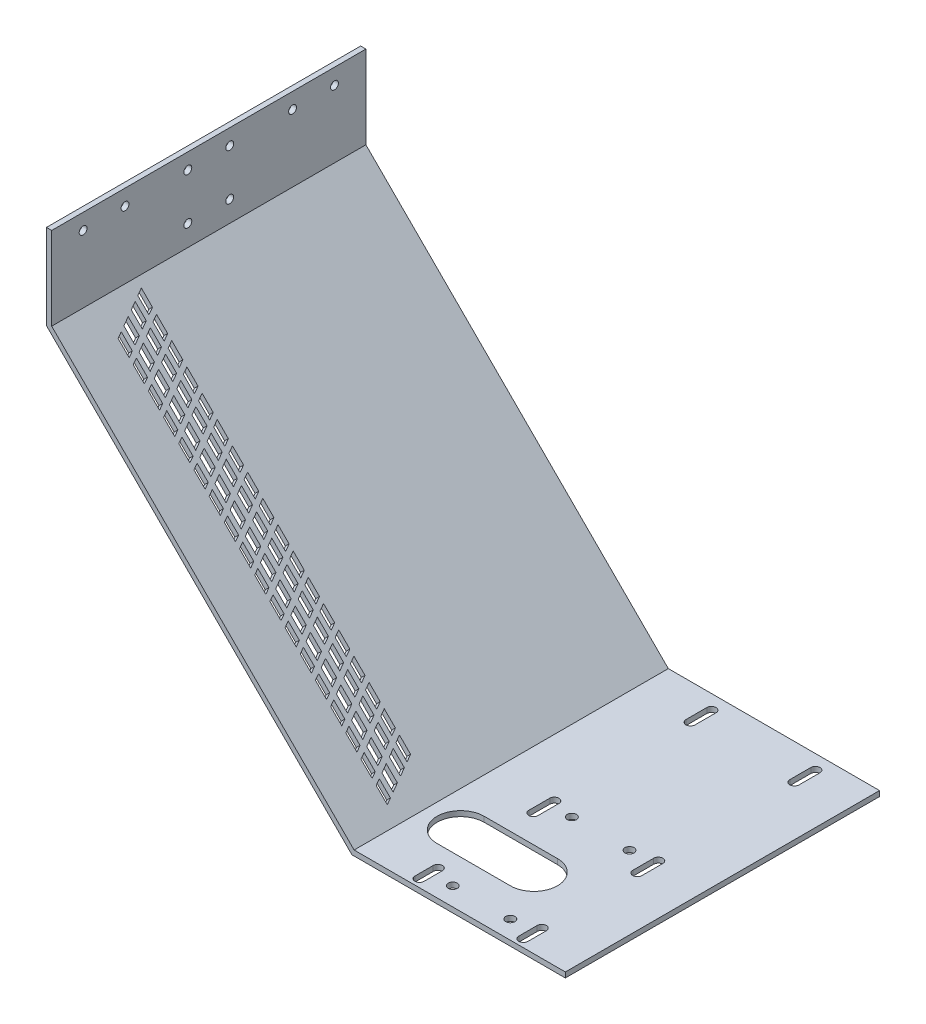
from build123d import *

# Parameters (mm, degrees)
EXTRUDE_1_DEPTH             = 120
CUT_EXTRUDE_1_DEPTH         = 307.169012533
CUT_EXTRUDE_2_DEPTH         = 276.189955977
CUT_EXTRUDE_3_DEPTH         = 276.189955977
CUT_EXTRUDE_4_DEPTH         = 276.189955977
CUT_EXTRUDE_5_DEPTH         = 276.189955977
CUT_EXTRUDE_6_DEPTH         = 276.189955977
CUT_EXTRUDE_7_DEPTH         = 276.189955977
CUT_EXTRUDE_8_DEPTH         = 204.855311096
CUT_EXTRUDE_9_DEPTH         = 204.855311096
CUT_EXTRUDE_10_DEPTH        = 204.855311096
CUT_EXTRUDE_11_DEPTH        = 204.855311096
CUT_EXTRUDE_12_DEPTH        = 204.855311096
CUT_EXTRUDE_13_DEPTH        = 204.855311096
CUT_EXTRUDE_14_DEPTH        = 204.855311096
CUT_EXTRUDE_15_DEPTH        = 204.855311096
CUT_EXTRUDE_16_DEPTH        = 204.855311096
CUT_EXTRUDE_17_DEPTH        = 204.855311096
CUT_EXTRUDE_18_DEPTH        = 204.855311096
CUT_EXTRUDE_19_DEPTH        = 204.855311096
CUT_EXTRUDE_20_DEPTH        = 204.855311096
CUT_EXTRUDE_21_DEPTH        = 204.855311096
CUT_EXTRUDE_22_DEPTH        = 204.855311096
CUT_EXTRUDE_23_DEPTH        = 204.855311096
CUT_EXTRUDE_24_DEPTH        = 204.855311096
CUT_EXTRUDE_25_DEPTH        = 204.855311096
CUT_EXTRUDE_26_DEPTH        = 204.855311096
CUT_EXTRUDE_27_DEPTH        = 204.855311096
CUT_EXTRUDE_28_DEPTH        = 204.855311096
CUT_EXTRUDE_29_DEPTH        = 204.855311096
CUT_EXTRUDE_30_DEPTH        = 204.855311096
CUT_EXTRUDE_31_DEPTH        = 204.855311096
CUT_EXTRUDE_32_DEPTH        = 204.855311096
CUT_EXTRUDE_33_DEPTH        = 204.855311096
CUT_EXTRUDE_34_DEPTH        = 204.855311096
CUT_EXTRUDE_35_DEPTH        = 204.855311096
CUT_EXTRUDE_36_DEPTH        = 204.855311096
CUT_EXTRUDE_37_DEPTH        = 204.855311096
CUT_EXTRUDE_38_DEPTH        = 204.855311096
CUT_EXTRUDE_39_DEPTH        = 204.855311096
CUT_EXTRUDE_40_DEPTH        = 204.855311096
CUT_EXTRUDE_41_DEPTH        = 204.855311096
CUT_EXTRUDE_42_DEPTH        = 204.855311096
CUT_EXTRUDE_43_DEPTH        = 204.855311096
CUT_EXTRUDE_44_DEPTH        = 204.855311096
CUT_EXTRUDE_45_DEPTH        = 204.855311096
CUT_EXTRUDE_46_DEPTH        = 204.855311096
CUT_EXTRUDE_47_DEPTH        = 204.855311096
CUT_EXTRUDE_48_DEPTH        = 204.855311096
CUT_EXTRUDE_49_DEPTH        = 204.855311096
CUT_EXTRUDE_50_DEPTH        = 204.855311096
CUT_EXTRUDE_51_DEPTH        = 204.855311096
CUT_EXTRUDE_52_DEPTH        = 204.855311096
CUT_EXTRUDE_53_DEPTH        = 204.855311096
CUT_EXTRUDE_54_DEPTH        = 204.855311096
CUT_EXTRUDE_55_DEPTH        = 204.855311096
CUT_EXTRUDE_56_DEPTH        = 204.855311096
CUT_EXTRUDE_57_DEPTH        = 204.855311096
CUT_EXTRUDE_58_DEPTH        = 204.855311096
CUT_EXTRUDE_59_DEPTH        = 204.855311096
CUT_EXTRUDE_60_DEPTH        = 204.855311096
CUT_EXTRUDE_61_DEPTH        = 204.855311096
CUT_EXTRUDE_62_DEPTH        = 204.855311096
CUT_EXTRUDE_63_DEPTH        = 204.855311096
CUT_EXTRUDE_64_DEPTH        = 204.855311096
CUT_EXTRUDE_65_DEPTH        = 204.855311096
CUT_EXTRUDE_66_DEPTH        = 204.855311096
CUT_EXTRUDE_67_DEPTH        = 204.855311096
CUT_EXTRUDE_68_DEPTH        = 204.855311096
CUT_EXTRUDE_69_DEPTH        = 204.855311096
CUT_EXTRUDE_70_DEPTH        = 204.855311096
CUT_EXTRUDE_71_DEPTH        = 204.855311096
CUT_EXTRUDE_72_DEPTH        = 204.855311096
CUT_EXTRUDE_73_DEPTH        = 204.855311096
CUT_EXTRUDE_74_DEPTH        = 204.855311096
CUT_EXTRUDE_75_DEPTH        = 204.855311096
CUT_EXTRUDE_76_DEPTH        = 204.855311096
CUT_EXTRUDE_77_DEPTH        = 204.855311096
CUT_EXTRUDE_78_DEPTH        = 204.855311096
CUT_EXTRUDE_79_DEPTH        = 204.855311096
CUT_EXTRUDE_80_DEPTH        = 277.26473236
HOLE_WIZARD_3_0_3_1_D       = 3
HOLE_WIZARD_3_0_3_1_DEPTH   = 198.172618896
HOLE_WIZARD_3_5_3_5_1_D     = 3.5
HOLE_WIZARD_3_5_3_5_1_DEPTH = 149.172618896
HOLE_WIZARD_3_0_3_2_D       = 3


with BuildPart() as part:
    # 草图1 → 凸台-拉伸1 (new body)
    with BuildSketch(Plane.XY):
        Polygon((-1, -199.172618896), (-1, -50), (-199.172618896, -50), (-199.172618896, -82.5), (-82.5, -199.172618896), align=None)
    extrude(amount=-EXTRUDE_1_DEPTH)

    # 草图2 → 切除-拉伸1 (cut, through all)
    with BuildSketch(Plane(origin=(0, 0, -120), x_dir=(-1, 0, 0), z_dir=(0, 0, -1))):
        Polygon((197.172618896, -81.671572875), (197.172618896, -50), (1, -50), (1, -197.172618896), (81.671572875, -197.172618896), align=None)
    extrude(amount=-CUT_EXTRUDE_1_DEPTH, mode=Mode.SUBTRACT)

    # 草图3 → 切除-拉伸2 (cut, through all)
    with BuildSketch(Plane(origin=(0, -197.172618896, 0), x_dir=(-1, 0, 0), z_dir=(0, 1, 0))):
        with BuildLine():
            Line((57.95, -106.5), (57.95, -114.5))
            ThreePointArc((57.95, -114.5), (59.7, -116.25), (61.45, -114.5))
            Line((61.45, -114.5), (61.45, -106.5))
            ThreePointArc((61.45, -106.5), (59.7, -104.75), (57.95, -106.5))
        make_face()
    extrude(amount=-CUT_EXTRUDE_2_DEPTH, mode=Mode.SUBTRACT)

    # 草图4 → 切除-拉伸3 (cut, through all)
    with BuildSketch(Plane(origin=(0, -197.172618896, 0), x_dir=(-1, 0, 0), z_dir=(0, 1, 0))):
        with BuildLine():
            Line((18.25, -106.5), (18.25, -114.5))
            ThreePointArc((18.25, -114.5), (20, -116.25), (21.75, -114.5))
            Line((21.75, -114.5), (21.75, -106.5))
            ThreePointArc((21.75, -106.5), (20, -104.75), (18.25, -106.5))
        make_face()
    extrude(amount=-CUT_EXTRUDE_3_DEPTH, mode=Mode.SUBTRACT)

    # 草图5 → 切除-拉伸4 (cut, through all)
    with BuildSketch(Plane(origin=(0, -197.172618896, 0), x_dir=(-1, 0, 0), z_dir=(0, 1, 0))):
        with BuildLine():
            Line((61.45, -54.5), (61.45, -46.5))
            ThreePointArc((61.45, -46.5), (59.7, -44.75), (57.95, -46.5))
            Line((57.95, -46.5), (57.95, -54.5))
            ThreePointArc((57.95, -54.5), (59.7, -56.25), (61.45, -54.5))
        make_face()
    extrude(amount=-CUT_EXTRUDE_4_DEPTH, mode=Mode.SUBTRACT)

    # 草图6 → 切除-拉伸5 (cut, through all)
    with BuildSketch(Plane(origin=(0, -197.172618896, 0), x_dir=(-1, 0, 0), z_dir=(0, 1, 0))):
        with BuildLine():
            Line((21.75, -54.5), (21.75, -46.5))
            ThreePointArc((21.75, -46.5), (20, -44.75), (18.25, -46.5))
            Line((18.25, -46.5), (18.25, -54.5))
            ThreePointArc((18.25, -54.5), (20, -56.25), (21.75, -54.5))
        make_face()
    extrude(amount=-CUT_EXTRUDE_5_DEPTH, mode=Mode.SUBTRACT)

    # 草图7 → 切除-拉伸6 (cut, through all)
    with BuildSketch(Plane(origin=(0, -197.172618896, 0), x_dir=(-1, 0, 0), z_dir=(0, 1, 0))):
        with BuildLine():
            Line((61.45, -10), (61.45, -3))
            ThreePointArc((61.45, -3), (59.7, -1.25), (57.95, -3))
            Line((57.95, -3), (57.95, -10))
            ThreePointArc((57.95, -10), (59.7, -11.75), (61.45, -10))
        make_face()
    extrude(amount=-CUT_EXTRUDE_6_DEPTH, mode=Mode.SUBTRACT)

    # 草图8 → 切除-拉伸7 (cut, through all)
    with BuildSketch(Plane(origin=(0, -197.172618896, 0), x_dir=(-1, 0, 0), z_dir=(0, 1, 0))):
        with BuildLine():
            Line((18.25, -3), (18.25, -10))
            ThreePointArc((18.25, -10), (20, -11.75), (21.75, -10))
            Line((21.75, -10), (21.75, -3))
            ThreePointArc((21.75, -3), (20, -1.25), (18.25, -3))
        make_face()
    extrude(amount=-CUT_EXTRUDE_7_DEPTH, mode=Mode.SUBTRACT)

    # 草图9 → 切除-拉伸8 (cut, through all)
    with BuildSketch(Plane(origin=(-139.422095886, -139.422095886, 0), x_dir=(-0.7071067811865475, 0.7071067811865477, 0), z_dir=(0.7071067811865477, 0.7071067811865475, 0))):
        Polygon((-55.009401077, -28), (-56.45277675, -25.5), (-62.45277675, -25.5), (-61.009401077, -28), align=None)
    extrude(amount=-CUT_EXTRUDE_8_DEPTH, mode=Mode.SUBTRACT)

    # 草图10 → 切除-拉伸9 (cut, through all)
    with BuildSketch(Plane(origin=(-139.422095886, -139.422095886, 0), x_dir=(-0.7071067811865475, 0.7071067811865477, 0), z_dir=(0.7071067811865477, 0.7071067811865475, 0))):
        Polygon((-57.607477288, -23.5), (-59.205553499, -20.732050808), (-65.205553499, -20.732050808), (-63.607477288, -23.5), align=None)
    extrude(amount=-CUT_EXTRUDE_9_DEPTH, mode=Mode.SUBTRACT)

    # 草图11 → 切除-拉伸10 (cut, through all)
    with BuildSketch(Plane(origin=(-139.422095886, -139.422095886, 0), x_dir=(-0.7071067811865475, 0.7071067811865477, 0), z_dir=(0.7071067811865477, 0.7071067811865475, 0))):
        Polygon((-51.809401077, -29.732050808), (-50.5, -32), (-44.5, -32), (-45.809401077, -29.732050808), align=None)
    extrude(amount=-CUT_EXTRUDE_10_DEPTH, mode=Mode.SUBTRACT)

    # 草图12 → 切除-拉伸11 (cut, through all)
    with BuildSketch(Plane(origin=(-139.422095886, -139.422095886, 0), x_dir=(-0.7071067811865475, 0.7071067811865477, 0), z_dir=(0.7071067811865477, 0.7071067811865475, 0))):
        Polygon((-46.809401077, -28), (-48.25277675, -25.5), (-54.25277675, -25.5), (-52.809401077, -28), align=None)
    extrude(amount=-CUT_EXTRUDE_11_DEPTH, mode=Mode.SUBTRACT)

    # 草图13 → 切除-拉伸12 (cut, through all)
    with BuildSketch(Plane(origin=(-139.422095886, -139.422095886, 0), x_dir=(-0.7071067811865475, 0.7071067811865477, 0), z_dir=(0.7071067811865477, 0.7071067811865475, 0))):
        Polygon((-49.407477288, -23.5), (-51.005553499, -20.732050808), (-57.005553499, -20.732050808), (-55.407477288, -23.5), align=None)
    extrude(amount=-CUT_EXTRUDE_12_DEPTH, mode=Mode.SUBTRACT)

    # 草图14 → 切除-拉伸13 (cut, through all)
    with BuildSketch(Plane(origin=(-139.422095886, -139.422095886, 0), x_dir=(-0.7071067811865475, 0.7071067811865477, 0), z_dir=(0.7071067811865477, 0.7071067811865475, 0))):
        Polygon((-43.609401077, -29.732050808), (-42.3, -32), (-36.3, -32), (-37.609401077, -29.732050808), align=None)
    extrude(amount=-CUT_EXTRUDE_13_DEPTH, mode=Mode.SUBTRACT)

    # 草图15 → 切除-拉伸14 (cut, through all)
    with BuildSketch(Plane(origin=(-139.422095886, -139.422095886, 0), x_dir=(-0.7071067811865475, 0.7071067811865477, 0), z_dir=(0.7071067811865477, 0.7071067811865475, 0))):
        Polygon((-38.609401077, -28), (-40.05277675, -25.5), (-46.05277675, -25.5), (-44.609401077, -28), align=None)
    extrude(amount=-CUT_EXTRUDE_14_DEPTH, mode=Mode.SUBTRACT)

    # 草图16 → 切除-拉伸15 (cut, through all)
    with BuildSketch(Plane(origin=(-139.422095886, -139.422095886, 0), x_dir=(-0.7071067811865475, 0.7071067811865477, 0), z_dir=(0.7071067811865477, 0.7071067811865475, 0))):
        Polygon((-41.207477288, -23.5), (-42.805553499, -20.732050808), (-48.805553499, -20.732050808), (-47.207477288, -23.5), align=None)
    extrude(amount=-CUT_EXTRUDE_15_DEPTH, mode=Mode.SUBTRACT)

    # 草图17 → 切除-拉伸16 (cut, through all)
    with BuildSketch(Plane(origin=(-139.422095886, -139.422095886, 0), x_dir=(-0.7071067811865475, 0.7071067811865477, 0), z_dir=(0.7071067811865477, 0.7071067811865475, 0))):
        Polygon((-35.409401077, -29.732050808), (-34.1, -32), (-28.1, -32), (-29.409401077, -29.732050808), align=None)
    extrude(amount=-CUT_EXTRUDE_16_DEPTH, mode=Mode.SUBTRACT)

    # 草图18 → 切除-拉伸17 (cut, through all)
    with BuildSketch(Plane(origin=(-139.422095886, -139.422095886, 0), x_dir=(-0.7071067811865475, 0.7071067811865477, 0), z_dir=(0.7071067811865477, 0.7071067811865475, 0))):
        Polygon((-30.409401077, -28), (-31.85277675, -25.5), (-37.85277675, -25.5), (-36.409401077, -28), align=None)
    extrude(amount=-CUT_EXTRUDE_17_DEPTH, mode=Mode.SUBTRACT)

    # 草图19 → 切除-拉伸18 (cut, through all)
    with BuildSketch(Plane(origin=(-139.422095886, -139.422095886, 0), x_dir=(-0.7071067811865475, 0.7071067811865477, 0), z_dir=(0.7071067811865477, 0.7071067811865475, 0))):
        Polygon((-33.007477288, -23.5), (-34.605553499, -20.732050808), (-40.605553499, -20.732050808), (-39.007477288, -23.5), align=None)
    extrude(amount=-CUT_EXTRUDE_18_DEPTH, mode=Mode.SUBTRACT)

    # 草图20 → 切除-拉伸19 (cut, through all)
    with BuildSketch(Plane(origin=(-139.422095886, -139.422095886, 0), x_dir=(-0.7071067811865475, 0.7071067811865477, 0), z_dir=(0.7071067811865477, 0.7071067811865475, 0))):
        Polygon((-27.209401077, -29.732050808), (-25.9, -32), (-19.9, -32), (-21.209401077, -29.732050808), align=None)
    extrude(amount=-CUT_EXTRUDE_19_DEPTH, mode=Mode.SUBTRACT)

    # 草图21 → 切除-拉伸20 (cut, through all)
    with BuildSketch(Plane(origin=(-139.422095886, -139.422095886, 0), x_dir=(-0.7071067811865475, 0.7071067811865477, 0), z_dir=(0.7071067811865477, 0.7071067811865475, 0))):
        Polygon((-22.209401077, -28), (-23.65277675, -25.5), (-29.65277675, -25.5), (-28.209401077, -28), align=None)
    extrude(amount=-CUT_EXTRUDE_20_DEPTH, mode=Mode.SUBTRACT)

    # 草图22 → 切除-拉伸21 (cut, through all)
    with BuildSketch(Plane(origin=(-139.422095886, -139.422095886, 0), x_dir=(-0.7071067811865475, 0.7071067811865477, 0), z_dir=(0.7071067811865477, 0.7071067811865475, 0))):
        Polygon((-24.807477288, -23.5), (-26.405553499, -20.732050808), (-32.4055535, -20.732050808), (-30.807477288, -23.5), align=None)
    extrude(amount=-CUT_EXTRUDE_21_DEPTH, mode=Mode.SUBTRACT)

    # 草图23 → 切除-拉伸22 (cut, through all)
    with BuildSketch(Plane(origin=(-139.422095886, -139.422095886, 0), x_dir=(-0.7071067811865475, 0.7071067811865477, 0), z_dir=(0.7071067811865477, 0.7071067811865475, 0))):
        Polygon((-19.009401077, -29.732050808), (-17.7, -32), (-11.7, -32), (-13.009401077, -29.732050808), align=None)
    extrude(amount=-CUT_EXTRUDE_22_DEPTH, mode=Mode.SUBTRACT)

    # 草图24 → 切除-拉伸23 (cut, through all)
    with BuildSketch(Plane(origin=(-139.422095886, -139.422095886, 0), x_dir=(-0.7071067811865475, 0.7071067811865477, 0), z_dir=(0.7071067811865477, 0.7071067811865475, 0))):
        Polygon((-14.009401077, -28), (-15.45277675, -25.5), (-21.45277675, -25.5), (-20.009401077, -28), align=None)
    extrude(amount=-CUT_EXTRUDE_23_DEPTH, mode=Mode.SUBTRACT)

    # 草图25 → 切除-拉伸24 (cut, through all)
    with BuildSketch(Plane(origin=(-139.422095886, -139.422095886, 0), x_dir=(-0.7071067811865475, 0.7071067811865477, 0), z_dir=(0.7071067811865477, 0.7071067811865475, 0))):
        Polygon((-16.607477288, -23.5), (-18.205553499, -20.732050808), (-24.205553499, -20.732050808), (-22.607477288, -23.5), align=None)
    extrude(amount=-CUT_EXTRUDE_24_DEPTH, mode=Mode.SUBTRACT)

    # 草图26 → 切除-拉伸25 (cut, through all)
    with BuildSketch(Plane(origin=(-139.422095886, -139.422095886, 0), x_dir=(-0.7071067811865475, 0.7071067811865477, 0), z_dir=(0.7071067811865477, 0.7071067811865475, 0))):
        Polygon((-10.809401077, -29.732050808), (-9.5, -32), (-3.5, -32), (-4.809401077, -29.732050808), align=None)
    extrude(amount=-CUT_EXTRUDE_25_DEPTH, mode=Mode.SUBTRACT)

    # 草图27 → 切除-拉伸26 (cut, through all)
    with BuildSketch(Plane(origin=(-139.422095886, -139.422095886, 0), x_dir=(-0.7071067811865475, 0.7071067811865477, 0), z_dir=(0.7071067811865477, 0.7071067811865475, 0))):
        Polygon((-5.809401077, -28), (-7.25277675, -25.5), (-13.25277675, -25.5), (-11.809401077, -28), align=None)
    extrude(amount=-CUT_EXTRUDE_26_DEPTH, mode=Mode.SUBTRACT)

    # 草图28 → 切除-拉伸27 (cut, through all)
    with BuildSketch(Plane(origin=(-139.422095886, -139.422095886, 0), x_dir=(-0.7071067811865475, 0.7071067811865477, 0), z_dir=(0.7071067811865477, 0.7071067811865475, 0))):
        Polygon((-8.407477288, -23.5), (-10.005553499, -20.732050808), (-16.005553499, -20.732050808), (-14.407477288, -23.5), align=None)
    extrude(amount=-CUT_EXTRUDE_27_DEPTH, mode=Mode.SUBTRACT)

    # 草图29 → 切除-拉伸28 (cut, through all)
    with BuildSketch(Plane(origin=(-139.422095886, -139.422095886, 0), x_dir=(-0.7071067811865475, 0.7071067811865477, 0), z_dir=(0.7071067811865477, 0.7071067811865475, 0))):
        Polygon((-2.609401077, -29.732050808), (-1.3, -32), (4.7, -32), (3.390598923, -29.732050808), align=None)
    extrude(amount=-CUT_EXTRUDE_28_DEPTH, mode=Mode.SUBTRACT)

    # 草图30 → 切除-拉伸29 (cut, through all)
    with BuildSketch(Plane(origin=(-139.422095886, -139.422095886, 0), x_dir=(-0.7071067811865475, 0.7071067811865477, 0), z_dir=(0.7071067811865477, 0.7071067811865475, 0))):
        Polygon((2.390598923, -28), (0.94722325, -25.5), (-5.05277675, -25.5), (-3.609401077, -28), align=None)
    extrude(amount=-CUT_EXTRUDE_29_DEPTH, mode=Mode.SUBTRACT)

    # 草图31 → 切除-拉伸30 (cut, through all)
    with BuildSketch(Plane(origin=(-139.422095886, -139.422095886, 0), x_dir=(-0.7071067811865475, 0.7071067811865477, 0), z_dir=(0.7071067811865477, 0.7071067811865475, 0))):
        Polygon((-0.207477288, -23.5), (-1.805553499, -20.732050808), (-7.805553499, -20.732050808), (-6.207477288, -23.5), align=None)
    extrude(amount=-CUT_EXTRUDE_30_DEPTH, mode=Mode.SUBTRACT)

    # 草图32 → 切除-拉伸31 (cut, through all)
    with BuildSketch(Plane(origin=(-139.422095886, -139.422095886, 0), x_dir=(-0.7071067811865475, 0.7071067811865477, 0), z_dir=(0.7071067811865477, 0.7071067811865475, 0))):
        Polygon((5.590598923, -29.732050808), (6.9, -32), (12.9, -32), (11.590598923, -29.732050808), align=None)
    extrude(amount=-CUT_EXTRUDE_31_DEPTH, mode=Mode.SUBTRACT)

    # 草图33 → 切除-拉伸32 (cut, through all)
    with BuildSketch(Plane(origin=(-139.422095886, -139.422095886, 0), x_dir=(-0.7071067811865475, 0.7071067811865477, 0), z_dir=(0.7071067811865477, 0.7071067811865475, 0))):
        Polygon((10.590598923, -28), (9.14722325, -25.5), (3.14722325, -25.5), (4.590598923, -28), align=None)
    extrude(amount=-CUT_EXTRUDE_32_DEPTH, mode=Mode.SUBTRACT)

    # 草图34 → 切除-拉伸33 (cut, through all)
    with BuildSketch(Plane(origin=(-139.422095886, -139.422095886, 0), x_dir=(-0.7071067811865475, 0.7071067811865477, 0), z_dir=(0.7071067811865477, 0.7071067811865475, 0))):
        Polygon((7.992522712, -23.5), (6.394446501, -20.732050808), (0.394446501, -20.732050808), (1.992522712, -23.5), align=None)
    extrude(amount=-CUT_EXTRUDE_33_DEPTH, mode=Mode.SUBTRACT)

    # 草图35 → 切除-拉伸34 (cut, through all)
    with BuildSketch(Plane(origin=(-139.422095886, -139.422095886, 0), x_dir=(-0.7071067811865475, 0.7071067811865477, 0), z_dir=(0.7071067811865477, 0.7071067811865475, 0))):
        Polygon((13.790598923, -29.732050808), (15.1, -32), (21.1, -32), (19.790598923, -29.732050808), align=None)
    extrude(amount=-CUT_EXTRUDE_34_DEPTH, mode=Mode.SUBTRACT)

    # 草图36 → 切除-拉伸35 (cut, through all)
    with BuildSketch(Plane(origin=(-139.422095886, -139.422095886, 0), x_dir=(-0.7071067811865475, 0.7071067811865477, 0), z_dir=(0.7071067811865477, 0.7071067811865475, 0))):
        Polygon((18.790598923, -28), (17.34722325, -25.5), (11.34722325, -25.5), (12.790598923, -28), align=None)
    extrude(amount=-CUT_EXTRUDE_35_DEPTH, mode=Mode.SUBTRACT)

    # 草图37 → 切除-拉伸36 (cut, through all)
    with BuildSketch(Plane(origin=(-139.422095886, -139.422095886, 0), x_dir=(-0.7071067811865475, 0.7071067811865477, 0), z_dir=(0.7071067811865477, 0.7071067811865475, 0))):
        Polygon((16.192522712, -23.5), (14.594446501, -20.732050808), (8.594446501, -20.732050808), (10.192522712, -23.5), align=None)
    extrude(amount=-CUT_EXTRUDE_36_DEPTH, mode=Mode.SUBTRACT)

    # 草图38 → 切除-拉伸37 (cut, through all)
    with BuildSketch(Plane(origin=(-139.422095886, -139.422095886, 0), x_dir=(-0.7071067811865475, 0.7071067811865477, 0), z_dir=(0.7071067811865477, 0.7071067811865475, 0))):
        Polygon((21.990598923, -29.732050808), (23.3, -32), (29.3, -32), (27.990598923, -29.732050808), align=None)
    extrude(amount=-CUT_EXTRUDE_37_DEPTH, mode=Mode.SUBTRACT)

    # 草图39 → 切除-拉伸38 (cut, through all)
    with BuildSketch(Plane(origin=(-139.422095886, -139.422095886, 0), x_dir=(-0.7071067811865475, 0.7071067811865477, 0), z_dir=(0.7071067811865477, 0.7071067811865475, 0))):
        Polygon((26.990598923, -28), (25.54722325, -25.5), (19.54722325, -25.5), (20.990598923, -28), align=None)
    extrude(amount=-CUT_EXTRUDE_38_DEPTH, mode=Mode.SUBTRACT)

    # 草图40 → 切除-拉伸39 (cut, through all)
    with BuildSketch(Plane(origin=(-139.422095886, -139.422095886, 0), x_dir=(-0.7071067811865475, 0.7071067811865477, 0), z_dir=(0.7071067811865477, 0.7071067811865475, 0))):
        Polygon((24.392522712, -23.5), (22.794446501, -20.732050808), (16.794446501, -20.732050808), (18.392522712, -23.5), align=None)
    extrude(amount=-CUT_EXTRUDE_39_DEPTH, mode=Mode.SUBTRACT)

    # 草图41 → 切除-拉伸40 (cut, through all)
    with BuildSketch(Plane(origin=(-139.422095886, -139.422095886, 0), x_dir=(-0.7071067811865475, 0.7071067811865477, 0), z_dir=(0.7071067811865477, 0.7071067811865475, 0))):
        Polygon((30.190598923, -29.732050808), (31.5, -32), (37.5, -32), (36.190598923, -29.732050808), align=None)
    extrude(amount=-CUT_EXTRUDE_40_DEPTH, mode=Mode.SUBTRACT)

    # 草图42 → 切除-拉伸41 (cut, through all)
    with BuildSketch(Plane(origin=(-139.422095886, -139.422095886, 0), x_dir=(-0.7071067811865475, 0.7071067811865477, 0), z_dir=(0.7071067811865477, 0.7071067811865475, 0))):
        Polygon((35.190598923, -28), (33.74722325, -25.5), (27.74722325, -25.5), (29.190598923, -28), align=None)
    extrude(amount=-CUT_EXTRUDE_41_DEPTH, mode=Mode.SUBTRACT)

    # 草图43 → 切除-拉伸42 (cut, through all)
    with BuildSketch(Plane(origin=(-139.422095886, -139.422095886, 0), x_dir=(-0.7071067811865475, 0.7071067811865477, 0), z_dir=(0.7071067811865477, 0.7071067811865475, 0))):
        Polygon((32.592522712, -23.5), (30.994446501, -20.732050808), (24.9944465, -20.732050808), (26.592522712, -23.5), align=None)
    extrude(amount=-CUT_EXTRUDE_42_DEPTH, mode=Mode.SUBTRACT)

    # 草图44 → 切除-拉伸43 (cut, through all)
    with BuildSketch(Plane(origin=(-139.422095886, -139.422095886, 0), x_dir=(-0.7071067811865475, 0.7071067811865477, 0), z_dir=(0.7071067811865477, 0.7071067811865475, 0))):
        Polygon((38.390598923, -29.732050808), (39.7, -32), (45.7, -32), (44.390598923, -29.732050808), align=None)
    extrude(amount=-CUT_EXTRUDE_43_DEPTH, mode=Mode.SUBTRACT)

    # 草图45 → 切除-拉伸44 (cut, through all)
    with BuildSketch(Plane(origin=(-139.422095886, -139.422095886, 0), x_dir=(-0.7071067811865475, 0.7071067811865477, 0), z_dir=(0.7071067811865477, 0.7071067811865475, 0))):
        Polygon((43.390598923, -28), (41.94722325, -25.5), (35.94722325, -25.5), (37.390598923, -28), align=None)
    extrude(amount=-CUT_EXTRUDE_44_DEPTH, mode=Mode.SUBTRACT)

    # 草图46 → 切除-拉伸45 (cut, through all)
    with BuildSketch(Plane(origin=(-139.422095886, -139.422095886, 0), x_dir=(-0.7071067811865475, 0.7071067811865477, 0), z_dir=(0.7071067811865477, 0.7071067811865475, 0))):
        Polygon((40.792522712, -23.5), (39.194446501, -20.732050808), (33.194446501, -20.732050808), (34.792522712, -23.5), align=None)
    extrude(amount=-CUT_EXTRUDE_45_DEPTH, mode=Mode.SUBTRACT)

    # 草图47 → 切除-拉伸46 (cut, through all)
    with BuildSketch(Plane(origin=(-139.422095886, -139.422095886, 0), x_dir=(-0.7071067811865475, 0.7071067811865477, 0), z_dir=(0.7071067811865477, 0.7071067811865475, 0))):
        Polygon((46.590598923, -29.732050808), (47.9, -32), (53.9, -32), (52.590598923, -29.732050808), align=None)
    extrude(amount=-CUT_EXTRUDE_46_DEPTH, mode=Mode.SUBTRACT)

    # 草图48 → 切除-拉伸47 (cut, through all)
    with BuildSketch(Plane(origin=(-139.422095886, -139.422095886, 0), x_dir=(-0.7071067811865475, 0.7071067811865477, 0), z_dir=(0.7071067811865477, 0.7071067811865475, 0))):
        Polygon((51.590598923, -28), (50.14722325, -25.5), (44.14722325, -25.5), (45.590598923, -28), align=None)
    extrude(amount=-CUT_EXTRUDE_47_DEPTH, mode=Mode.SUBTRACT)

    # 草图49 → 切除-拉伸48 (cut, through all)
    with BuildSketch(Plane(origin=(-139.422095886, -139.422095886, 0), x_dir=(-0.7071067811865475, 0.7071067811865477, 0), z_dir=(0.7071067811865477, 0.7071067811865475, 0))):
        Polygon((48.992522712, -23.5), (47.394446501, -20.732050808), (41.394446501, -20.732050808), (42.992522712, -23.5), align=None)
    extrude(amount=-CUT_EXTRUDE_48_DEPTH, mode=Mode.SUBTRACT)

    # 草图50 → 切除-拉伸49 (cut, through all)
    with BuildSketch(Plane(origin=(-139.422095886, -139.422095886, 0), x_dir=(-0.7071067811865475, 0.7071067811865477, 0), z_dir=(0.7071067811865477, 0.7071067811865475, 0))):
        Polygon((54.790598923, -29.732050808), (56.1, -32), (62.1, -32), (60.790598923, -29.732050808), align=None)
    extrude(amount=-CUT_EXTRUDE_49_DEPTH, mode=Mode.SUBTRACT)

    # 草图51 → 切除-拉伸50 (cut, through all)
    with BuildSketch(Plane(origin=(-139.422095886, -139.422095886, 0), x_dir=(-0.7071067811865475, 0.7071067811865477, 0), z_dir=(0.7071067811865477, 0.7071067811865475, 0))):
        Polygon((59.790598923, -28), (58.34722325, -25.5), (52.34722325, -25.5), (53.790598923, -28), align=None)
    extrude(amount=-CUT_EXTRUDE_50_DEPTH, mode=Mode.SUBTRACT)

    # 草图52 → 切除-拉伸51 (cut, through all)
    with BuildSketch(Plane(origin=(-139.422095886, -139.422095886, 0), x_dir=(-0.7071067811865475, 0.7071067811865477, 0), z_dir=(0.7071067811865477, 0.7071067811865475, 0))):
        Polygon((57.192522712, -23.5), (55.594446501, -20.732050808), (49.594446501, -20.732050808), (51.192522712, -23.5), align=None)
    extrude(amount=-CUT_EXTRUDE_51_DEPTH, mode=Mode.SUBTRACT)

    # 草图53 → 切除-拉伸52 (cut, through all)
    with BuildSketch(Plane(origin=(-139.422095886, -139.422095886, 0), x_dir=(-0.7071067811865475, 0.7071067811865477, 0), z_dir=(0.7071067811865477, 0.7071067811865475, 0))):
        Polygon((-68.405553499, -19), (-69.560254038, -17), (-75.560254038, -17), (-74.405553499, -19), align=None)
    extrude(amount=-CUT_EXTRUDE_52_DEPTH, mode=Mode.SUBTRACT)

    # 草图54 → 切除-拉伸53 (cut, through all)
    with BuildSketch(Plane(origin=(-139.422095886, -139.422095886, 0), x_dir=(-0.7071067811865475, 0.7071067811865477, 0), z_dir=(0.7071067811865477, 0.7071067811865475, 0))):
        Polygon((62.990598923, -29.732050808), (64.3, -32), (70.3, -32), (68.990598923, -29.732050808), align=None)
    extrude(amount=-CUT_EXTRUDE_53_DEPTH, mode=Mode.SUBTRACT)

    # 草图55 → 切除-拉伸54 (cut, through all)
    with BuildSketch(Plane(origin=(-139.422095886, -139.422095886, 0), x_dir=(-0.7071067811865475, 0.7071067811865477, 0), z_dir=(0.7071067811865477, 0.7071067811865475, 0))):
        Polygon((67.990598923, -28), (66.54722325, -25.5), (60.54722325, -25.5), (61.990598923, -28), align=None)
    extrude(amount=-CUT_EXTRUDE_54_DEPTH, mode=Mode.SUBTRACT)

    # 草图56 → 切除-拉伸55 (cut, through all)
    with BuildSketch(Plane(origin=(-139.422095886, -139.422095886, 0), x_dir=(-0.7071067811865475, 0.7071067811865477, 0), z_dir=(0.7071067811865477, 0.7071067811865475, 0))):
        Polygon((65.392522712, -23.5), (63.794446501, -20.732050808), (57.794446501, -20.732050808), (59.392522712, -23.5), align=None)
    extrude(amount=-CUT_EXTRUDE_55_DEPTH, mode=Mode.SUBTRACT)

    # 草图57 → 切除-拉伸56 (cut, through all)
    with BuildSketch(Plane(origin=(-139.422095886, -139.422095886, 0), x_dir=(-0.7071067811865475, 0.7071067811865477, 0), z_dir=(0.7071067811865477, 0.7071067811865475, 0))):
        Polygon((-73.405553499, -20.732050808), (-71.807477288, -23.5), (-65.807477288, -23.5), (-67.405553499, -20.732050808), align=None)
    extrude(amount=-CUT_EXTRUDE_56_DEPTH, mode=Mode.SUBTRACT)

    # 草图58 → 切除-拉伸57 (cut, through all)
    with BuildSketch(Plane(origin=(-139.422095886, -139.422095886, 0), x_dir=(-0.7071067811865475, 0.7071067811865477, 0), z_dir=(0.7071067811865477, 0.7071067811865475, 0))):
        Polygon((-70.65277675, -25.5), (-69.209401077, -28), (-63.209401077, -28), (-64.65277675, -25.5), align=None)
    extrude(amount=-CUT_EXTRUDE_57_DEPTH, mode=Mode.SUBTRACT)

    # 草图59 → 切除-拉伸58 (cut, through all)
    with BuildSketch(Plane(origin=(-139.422095886, -139.422095886, 0), x_dir=(-0.7071067811865475, 0.7071067811865477, 0), z_dir=(0.7071067811865477, 0.7071067811865475, 0))):
        Polygon((65.994446501, -20.732050808), (67.592522712, -23.5), (73.592522712, -23.5), (71.994446501, -20.732050808), align=None)
    extrude(amount=-CUT_EXTRUDE_58_DEPTH, mode=Mode.SUBTRACT)

    # 草图60 → 切除-拉伸59 (cut, through all)
    with BuildSketch(Plane(origin=(-139.422095886, -139.422095886, 0), x_dir=(-0.7071067811865475, 0.7071067811865477, 0), z_dir=(0.7071067811865477, 0.7071067811865475, 0))):
        Polygon((68.74722325, -25.5), (70.190598923, -28), (76.190598923, -28), (74.74722325, -25.5), align=None)
    extrude(amount=-CUT_EXTRUDE_59_DEPTH, mode=Mode.SUBTRACT)

    # 草图61 → 切除-拉伸60 (cut, through all)
    with BuildSketch(Plane(origin=(-139.422095886, -139.422095886, 0), x_dir=(-0.7071067811865475, 0.7071067811865477, 0), z_dir=(0.7071067811865477, 0.7071067811865475, 0))):
        Polygon((71.190598923, -29.732050808), (72.5, -32), (78.5, -32), (77.190598923, -29.732050808), align=None)
    extrude(amount=-CUT_EXTRUDE_60_DEPTH, mode=Mode.SUBTRACT)

    # 草图62 → 切除-拉伸61 (cut, through all)
    with BuildSketch(Plane(origin=(-139.422095886, -139.422095886, 0), x_dir=(-0.7071067811865475, 0.7071067811865477, 0), z_dir=(0.7071067811865477, 0.7071067811865475, 0))):
        Polygon((-60.009401077, -29.732050808), (-58.7, -32), (-52.7, -32), (-54.009401077, -29.732050808), align=None)
    extrude(amount=-CUT_EXTRUDE_61_DEPTH, mode=Mode.SUBTRACT)

    # 草图63 → 切除-拉伸62 (cut, through all)
    with BuildSketch(Plane(origin=(-139.422095886, -139.422095886, 0), x_dir=(-0.7071067811865475, 0.7071067811865477, 0), z_dir=(0.7071067811865477, 0.7071067811865475, 0))):
        Polygon((70.994446501, -19), (69.839745962, -17), (63.839745962, -17), (64.994446501, -19), align=None)
    extrude(amount=-CUT_EXTRUDE_62_DEPTH, mode=Mode.SUBTRACT)

    # 草图64 → 切除-拉伸63 (cut, through all)
    with BuildSketch(Plane(origin=(-139.422095886, -139.422095886, 0), x_dir=(-0.7071067811865475, 0.7071067811865477, 0), z_dir=(0.7071067811865477, 0.7071067811865475, 0))):
        Polygon((-68.209401077, -29.732050808), (-66.9, -32), (-60.9, -32), (-62.209401077, -29.732050808), align=None)
    extrude(amount=-CUT_EXTRUDE_63_DEPTH, mode=Mode.SUBTRACT)

    # 草图65 → 切除-拉伸64 (cut, through all)
    with BuildSketch(Plane(origin=(-139.422095886, -139.422095886, 0), x_dir=(-0.7071067811865475, 0.7071067811865477, 0), z_dir=(0.7071067811865477, 0.7071067811865475, 0))):
        Polygon((62.794446501, -19), (61.639745962, -17), (55.639745962, -17), (56.794446501, -19), align=None)
    extrude(amount=-CUT_EXTRUDE_64_DEPTH, mode=Mode.SUBTRACT)

    # 草图66 → 切除-拉伸65 (cut, through all)
    with BuildSketch(Plane(origin=(-139.422095886, -139.422095886, 0), x_dir=(-0.7071067811865475, 0.7071067811865477, 0), z_dir=(0.7071067811865477, 0.7071067811865475, 0))):
        Polygon((54.594446501, -19), (53.439745962, -17), (47.439745962, -17), (48.594446501, -19), align=None)
    extrude(amount=-CUT_EXTRUDE_65_DEPTH, mode=Mode.SUBTRACT)

    # 草图67 → 切除-拉伸66 (cut, through all)
    with BuildSketch(Plane(origin=(-139.422095886, -139.422095886, 0), x_dir=(-0.7071067811865475, 0.7071067811865477, 0), z_dir=(0.7071067811865477, 0.7071067811865475, 0))):
        Polygon((46.394446501, -19), (45.239745962, -17), (39.239745962, -17), (40.394446501, -19), align=None)
    extrude(amount=-CUT_EXTRUDE_66_DEPTH, mode=Mode.SUBTRACT)

    # 草图68 → 切除-拉伸67 (cut, through all)
    with BuildSketch(Plane(origin=(-139.422095886, -139.422095886, 0), x_dir=(-0.7071067811865475, 0.7071067811865477, 0), z_dir=(0.7071067811865477, 0.7071067811865475, 0))):
        Polygon((38.194446501, -19), (37.039745962, -17), (31.039745962, -17), (32.194446501, -19), align=None)
    extrude(amount=-CUT_EXTRUDE_67_DEPTH, mode=Mode.SUBTRACT)

    # 草图69 → 切除-拉伸68 (cut, through all)
    with BuildSketch(Plane(origin=(-139.422095886, -139.422095886, 0), x_dir=(-0.7071067811865475, 0.7071067811865477, 0), z_dir=(0.7071067811865477, 0.7071067811865475, 0))):
        Polygon((29.9944465, -19), (28.839745962, -17), (22.839745962, -17), (23.994446501, -19), align=None)
    extrude(amount=-CUT_EXTRUDE_68_DEPTH, mode=Mode.SUBTRACT)

    # 草图70 → 切除-拉伸69 (cut, through all)
    with BuildSketch(Plane(origin=(-139.422095886, -139.422095886, 0), x_dir=(-0.7071067811865475, 0.7071067811865477, 0), z_dir=(0.7071067811865477, 0.7071067811865475, 0))):
        Polygon((21.794446501, -19), (20.639745962, -17), (14.639745962, -17), (15.794446501, -19), align=None)
    extrude(amount=-CUT_EXTRUDE_69_DEPTH, mode=Mode.SUBTRACT)

    # 草图71 → 切除-拉伸70 (cut, through all)
    with BuildSketch(Plane(origin=(-139.422095886, -139.422095886, 0), x_dir=(-0.7071067811865475, 0.7071067811865477, 0), z_dir=(0.7071067811865477, 0.7071067811865475, 0))):
        Polygon((13.594446501, -19), (12.439745962, -17), (6.439745962, -17), (7.594446501, -19), align=None)
    extrude(amount=-CUT_EXTRUDE_70_DEPTH, mode=Mode.SUBTRACT)

    # 草图72 → 切除-拉伸71 (cut, through all)
    with BuildSketch(Plane(origin=(-139.422095886, -139.422095886, 0), x_dir=(-0.7071067811865475, 0.7071067811865477, 0), z_dir=(0.7071067811865477, 0.7071067811865475, 0))):
        Polygon((5.394446501, -19), (4.239745962, -17), (-1.760254038, -17), (-0.605553499, -19), align=None)
    extrude(amount=-CUT_EXTRUDE_71_DEPTH, mode=Mode.SUBTRACT)

    # 草图73 → 切除-拉伸72 (cut, through all)
    with BuildSketch(Plane(origin=(-139.422095886, -139.422095886, 0), x_dir=(-0.7071067811865475, 0.7071067811865477, 0), z_dir=(0.7071067811865477, 0.7071067811865475, 0))):
        Polygon((-2.805553499, -19), (-3.960254038, -17), (-9.960254038, -17), (-8.805553499, -19), align=None)
    extrude(amount=-CUT_EXTRUDE_72_DEPTH, mode=Mode.SUBTRACT)

    # 草图74 → 切除-拉伸73 (cut, through all)
    with BuildSketch(Plane(origin=(-139.422095886, -139.422095886, 0), x_dir=(-0.7071067811865475, 0.7071067811865477, 0), z_dir=(0.7071067811865477, 0.7071067811865475, 0))):
        Polygon((-11.005553499, -19), (-12.160254038, -17), (-18.160254038, -17), (-17.005553499, -19), align=None)
    extrude(amount=-CUT_EXTRUDE_73_DEPTH, mode=Mode.SUBTRACT)

    # 草图75 → 切除-拉伸74 (cut, through all)
    with BuildSketch(Plane(origin=(-139.422095886, -139.422095886, 0), x_dir=(-0.7071067811865475, 0.7071067811865477, 0), z_dir=(0.7071067811865477, 0.7071067811865475, 0))):
        Polygon((-19.205553499, -19), (-20.360254038, -17), (-26.360254038, -17), (-25.205553499, -19), align=None)
    extrude(amount=-CUT_EXTRUDE_74_DEPTH, mode=Mode.SUBTRACT)

    # 草图76 → 切除-拉伸75 (cut, through all)
    with BuildSketch(Plane(origin=(-139.422095886, -139.422095886, 0), x_dir=(-0.7071067811865475, 0.7071067811865477, 0), z_dir=(0.7071067811865477, 0.7071067811865475, 0))):
        Polygon((-27.405553499, -19), (-28.560254038, -17), (-34.560254038, -17), (-33.405553499, -19), align=None)
    extrude(amount=-CUT_EXTRUDE_75_DEPTH, mode=Mode.SUBTRACT)

    # 草图77 → 切除-拉伸76 (cut, through all)
    with BuildSketch(Plane(origin=(-139.422095886, -139.422095886, 0), x_dir=(-0.7071067811865475, 0.7071067811865477, 0), z_dir=(0.7071067811865477, 0.7071067811865475, 0))):
        Polygon((-35.605553499, -19), (-36.760254038, -17), (-42.760254038, -17), (-41.605553499, -19), align=None)
    extrude(amount=-CUT_EXTRUDE_76_DEPTH, mode=Mode.SUBTRACT)

    # 草图78 → 切除-拉伸77 (cut, through all)
    with BuildSketch(Plane(origin=(-139.422095886, -139.422095886, 0), x_dir=(-0.7071067811865475, 0.7071067811865477, 0), z_dir=(0.7071067811865477, 0.7071067811865475, 0))):
        Polygon((-43.805553499, -19), (-44.960254038, -17), (-50.960254038, -17), (-49.805553499, -19), align=None)
    extrude(amount=-CUT_EXTRUDE_77_DEPTH, mode=Mode.SUBTRACT)

    # 草图79 → 切除-拉伸78 (cut, through all)
    with BuildSketch(Plane(origin=(-139.422095886, -139.422095886, 0), x_dir=(-0.7071067811865475, 0.7071067811865477, 0), z_dir=(0.7071067811865477, 0.7071067811865475, 0))):
        Polygon((-52.005553499, -19), (-53.160254038, -17), (-59.160254038, -17), (-58.005553499, -19), align=None)
    extrude(amount=-CUT_EXTRUDE_78_DEPTH, mode=Mode.SUBTRACT)

    # 草图80 → 切除-拉伸79 (cut, through all)
    with BuildSketch(Plane(origin=(-139.422095886, -139.422095886, 0), x_dir=(-0.7071067811865475, 0.7071067811865477, 0), z_dir=(0.7071067811865477, 0.7071067811865475, 0))):
        Polygon((-60.205553499, -19), (-61.360254038, -17), (-67.360254038, -17), (-66.205553499, -19), align=None)
    extrude(amount=-CUT_EXTRUDE_79_DEPTH, mode=Mode.SUBTRACT)

    # 草图81 → 切除-拉伸80 (cut, through all)
    with BuildSketch(Plane.XZ.offset(199.172618896)):
        with BuildLine():
            Line((-40, -18), (-68, -18))
            ThreePointArc((-68, -18), (-77, -27), (-68, -36))
            Line((-68, -36), (-40, -36))
            ThreePointArc((-40, -36), (-31, -27), (-40, -18))
        make_face()
    extrude(amount=-CUT_EXTRUDE_80_DEPTH, mode=Mode.SUBTRACT)

    # Ø3.0 (3) 直径孔1
    with Locations(Plane.ZY.offset(199.172618896)):
        with Locations((-68, -56), (-52, -56)):
            Hole(HOLE_WIZARD_3_0_3_1_D / 2, depth=HOLE_WIZARD_3_0_3_1_DEPTH)

    # Ø3.5 (3.5) 直径孔1
    with Locations(Plane(origin=(0, -199.172618896, 0), x_dir=(-1, 0, 0), z_dir=(0, -1, 0))):
        with Locations((51, 7), (29, 7), (51, 52.5), (29, 52.5)):
            Hole(HOLE_WIZARD_3_5_3_5_1_D / 2, depth=HOLE_WIZARD_3_5_3_5_1_DEPTH)

    # Ø3.0 (3) 直径孔2 (through all)
    with Locations(Plane(origin=(-197.172618896, 0, 0), x_dir=(0, 0, -1), z_dir=(1, 0, 0))):
        with Locations((68, -73.671572875), (52, -73.671572875), (108, -56), (92, -56), (12, -56), (28, -56)):
            Hole(HOLE_WIZARD_3_0_3_2_D / 2)


solid = part.part
